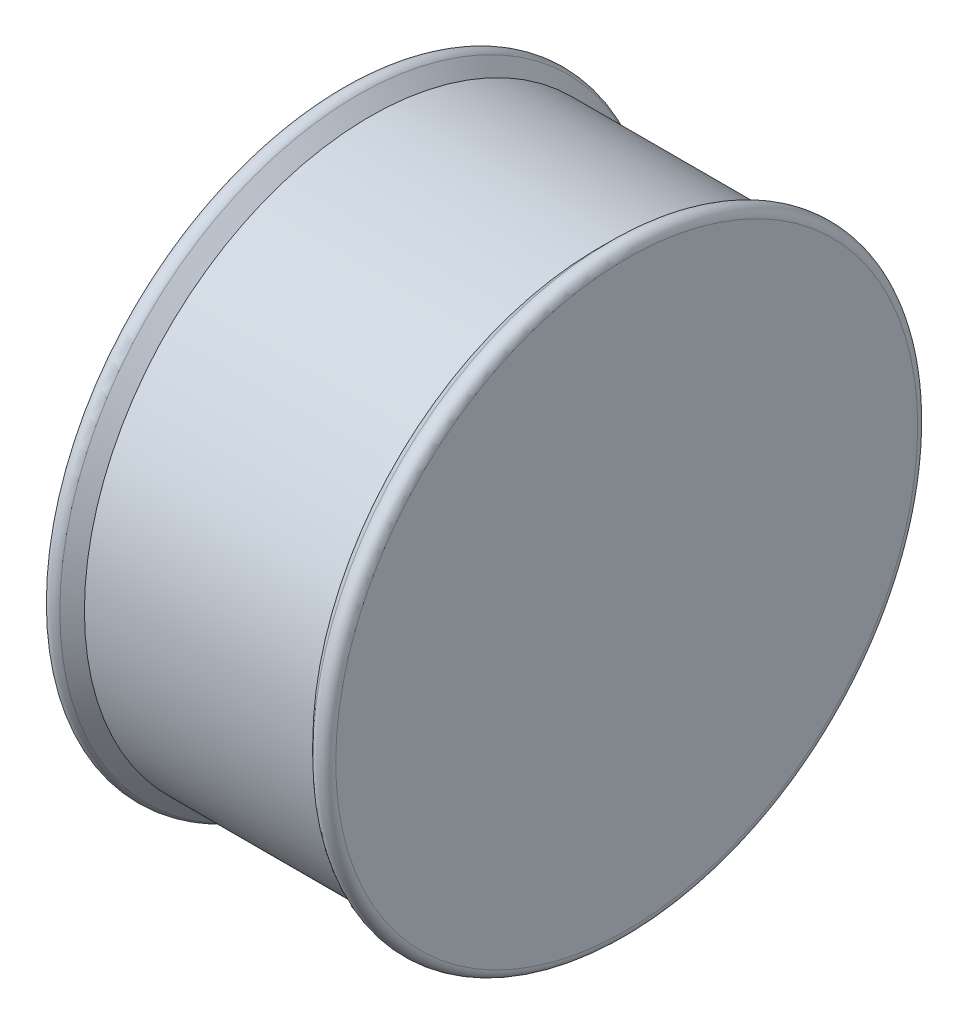
from build123d import *

# Parameters (mm, degrees)
REDONDEO2_R             = 0.5
MOVER_CARA1_BY          = 0.6
CROQUIS3_R              = 4.8
CROQUIS3_R_2            = 2.8
SALIENTE_EXTRUIR1_DEPTH = 17
NERVIO4_REACH           = 28.904
CROQUIS5_WALLS_W        = 1.6
CROQUIS5_WALLS_H        = 65.245471754
MATRIZC1_COUNT          = 4
CHAFL_N1_SIZE           = 0.4


# Read off the part's stored shape, not the designer's step: Vaciado1
with BuildPart() as part:
    # Croquis2 → Revolución1 (revolve)
    with BuildSketch(Plane.XY, mode=Mode.PRIVATE) as revoluci_n1_sk:
        Polygon((-7.5, 0), (7.5, 0), (7.5, 16.5), (6, 15), (-6, 15), (-7.5, 16.5), align=None)
    revolve(revoluci_n1_sk.sketch.rotate(Axis((-7.5, 0, 0), (1, 0, 0)), 90), axis=Axis((-7.5, 0, 0), (1, 0, 0)))

    # Vaciado1 outline → Vaciado1 (revolve, cut)
    with BuildSketch(Plane.YX):
        Polygon((13.4, 5.9), (0, 5.9), (0, -7.5), (14.2372583, -7.5), (13.4, -6.6627417), align=None)
    revolve(axis=Axis((0, 0, 0), (1, 0, 0)), mode=Mode.SUBTRACT)

    # Redondeo2
    redondeo2_edges = [part.edges().sort_by_distance(p)[0] for p in [
        (-7.5, 0, -16.5),
        (7.5, 0, -16.5),
    ]]
    fillet(redondeo2_edges, radius=REDONDEO2_R)

    # Mover cara1: a face moved inward by 0.6
    extrude(part.faces().sort_by_distance((5.9, 0, 0))[0], amount=MOVER_CARA1_BY, dir=(1, 0, 0), mode=Mode.SUBTRACT)

    # Croquis3 → Saliente-Extruir1 (add)
    # profile 1 of 3: a face of its own
    with BuildSketch(Plane.ZY.offset(-6.5)):
        Circle(CROQUIS3_R)
        Circle(CROQUIS3_R_2, mode=Mode.SUBTRACT)
    # profile 2 of 3: a face of its own
    with BuildSketch(Plane.ZY.offset(-6.5)):
        with BuildLine():
            ThreePointArc((2.8, 0), (2.592296279, 1.058300524), (2, 1.959591794))
            Line((2, 1.959591794), (2, -1.959591794))
            ThreePointArc((2, -1.959591794), (2.592296279, -1.058300524), (2.8, 0))
        make_face()
    # profile 3 of 3: a face of its own
    with BuildSketch(Plane.ZY.offset(-6.5)):
        with BuildLine():
            Line((-2, -1.959591794), (-2, 1.959591794))
            ThreePointArc((-2, 1.959591794), (-2.8, 0), (-2, -1.959591794))
        make_face()
    extrude(amount=SALIENTE_EXTRUIR1_DEPTH)

    # Croquis5 walls → Nervio4 (add, up to next)
    with BuildSketch(Plane.ZY.offset(7.5), mode=Mode.PRIVATE) as nervio4_sk1:
        with Locations((0, 9.51862915)):
            Rectangle(CROQUIS5_WALLS_W, CROQUIS5_WALLS_H)
    nervio4_tool1 = extrude(nervio4_sk1.sketch, amount=-NERVIO4_REACH, mode=Mode.PRIVATE) - part.part
    nervio4 = nervio4_tool1.solids().sort_by_distance((-7.5, 9.51862915, 0))[0]
    add(nervio4)

    # MatrizC1: Nervio4 ×4 about axis
    matrizc1_axis = Axis((0, 0, 0), (1, 0, 0))
    for i in range(1, MATRIZC1_COUNT):
        add(nervio4.rotate(matrizc1_axis, i * 360 / MATRIZC1_COUNT))

    # Chaflán1
    chafl_n1_edges = [part.edges().sort_by_distance(p)[0] for p in [
        (-10.5, 0, -2),
        (-10.5, 2.8, 0),
        (-10.5, -2.8, 0),
        (-10.5, 0, 2),
    ]]
    chamfer(chafl_n1_edges, length=CHAFL_N1_SIZE)


solid = part.part
